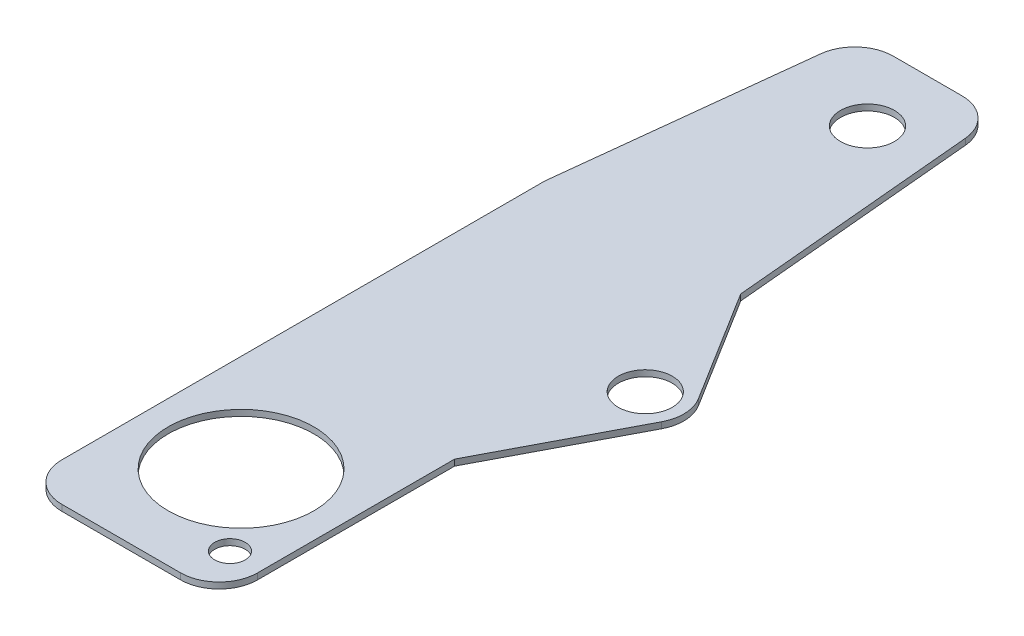
from build123d import *

# Parameters (mm, degrees)
SKETCH1_R           = 18.9
SKETCH1_R_2         = 3.960069723
SKETCH1_R_3         = 7
BOSS_EXTRUDE1_DEPTH = 1.5875
SKETCH4_W           = 66.272407177
SKETCH4_H           = 27.800260981
CUT_EXTRUDE2_DEPTH  = 20
FILLET3_R           = 10
FILLET4_R           = 10
BOSS_EXTRUDE3_START = -1.5875
BOSS_EXTRUDE3_DEPTH = 1.5875
SKETCH7_R           = 7
CUT_EXTRUDE3_DEPTH  = 1.5875


with BuildPart() as part:
    # Sketch1 → Boss-Extrude1 (new body)
    with BuildSketch(Plane(origin=(0, 0, 0), x_dir=(1, 0, 0), z_dir=(0, 1, 0))):
        with BuildLine():
            Line((42.32729629, 228.6), (10.454309325, 228.6))
            Line((10.454309325, 228.6), (0, 135.362739137))
            Line((0, 135.362739137), (0, 0))
            Line((0, 0), (24.327009544, 0))
            Line((24.327009544, 0), (50.8, 0))
            Line((50.8, 0), (50.8, 64.87909603))
            Line((50.8, 64.87909603), (50.8, 87.423477361))
            Line((50.8, 87.423477361), (50.8, 98.200996728))
            ThreePointArc((50.8, 98.200996728), (50.4, 101.000996728), (50.8, 103.800996728))
            Line((50.8, 103.800996728), (50.8, 104.488200565))
            Line((50.8, 104.488200565), (50.8, 120.619222808))
            Line((50.8, 120.619222808), (50.8, 135.362739137))
            Line((50.8, 135.362739137), (42.32729629, 228.6))
        make_face()
        with Locations((25.271589382, 31.225922091)):
            Circle(SKETCH1_R, mode=Mode.SUBTRACT)
        with Locations((42.32729629, 11.29561028)):
            Circle(SKETCH1_R_2, mode=Mode.SUBTRACT)
        with Locations((29.504213454, 189.557234372)):
            Circle(SKETCH1_R_3, mode=Mode.SUBTRACT)
    extrude(amount=BOSS_EXTRUDE1_DEPTH)

    # Sketch4 → Cut-Extrude2 (cut)
    with BuildSketch(Plane(origin=(0, 0, -228.6), x_dir=(-1, 0, 0), z_dir=(0, 0, -1))):
        with Locations((-28.174690156, -1.980940155)):
            Rectangle(SKETCH4_W, SKETCH4_H)
    extrude(amount=-CUT_EXTRUDE2_DEPTH, mode=Mode.SUBTRACT)

    # Fillet3
    fillet3_edges = [part.edges().sort_by_distance(p)[0] for p in [
        (44.144746445, 0.79375, -208.6),
    ]]
    fillet(fillet3_edges, radius=FILLET3_R)

    # Fillet4
    fillet4_edges = [part.edges().sort_by_distance(p)[0] for p in [
        (50.8, 0.79375, 0),
        (0, 0.79375, 0),
        (8.211791854, 0.79375, -208.6),
    ]]
    fillet(fillet4_edges, radius=FILLET4_R)

    # Sketch6 → Boss-Extrude3 (add)
    with BuildSketch(Plane(origin=(0, 1.5875, 0), x_dir=(1, 0, 0), z_dir=(0, 1, 0)).offset(BOSS_EXTRUDE3_START)):
        with BuildLine():
            Line((50.8, 135.362739137), (50.8, 103.800996728))
            ThreePointArc((50.8, 103.800996728), (50.4, 101.000996728), (50.8, 98.200996728))
            Line((50.8, 98.200996728), (50.8, 61.124243317))
            Line((50.8, 61.124243317), (69.258211507, 96.360728536))
            ThreePointArc((69.258211507, 96.360728536), (70.393157133, 101.370875786), (68.890940865, 106.283413148))
            Line((68.890940865, 106.283413148), (50.8, 135.362739137))
        make_face()
    extrude(amount=BOSS_EXTRUDE3_DEPTH)

    # Sketch7 → Cut-Extrude3 (cut)
    with BuildSketch(Plane(origin=(0, 1.5875, 0), x_dir=(1, 0, 0), z_dir=(0, 1, 0))):
        with Locations((60.4, 101.000996728)):
            Circle(SKETCH7_R)
    extrude(amount=-CUT_EXTRUDE3_DEPTH, mode=Mode.SUBTRACT)


solid = part.part
